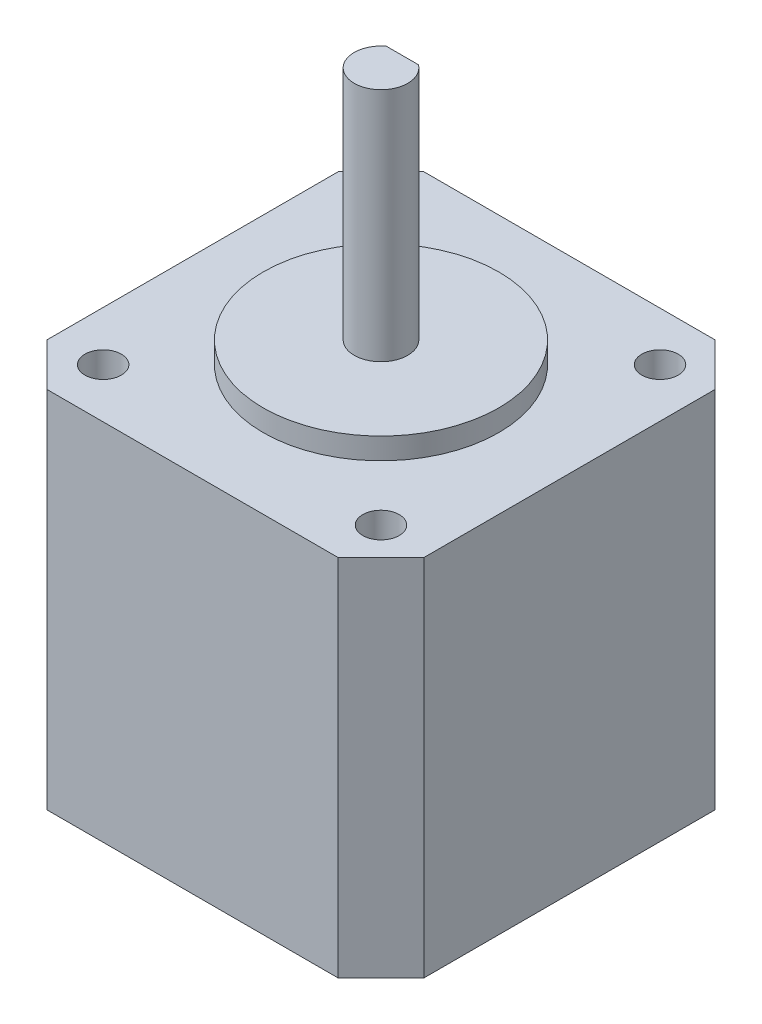
from build123d import *
from build123d.topology import SkipClean

# Parameters (mm, degrees)
SKETCH1_R           = 1.7
BOSS_EXTRUDE1_DEPTH = 34
SKETCH2_R           = 11
BOSS_EXTRUDE2_DEPTH = 2
SKETCH3_R           = 2.5
BOSS_EXTRUDE3_DEPTH = 5.5
BOSS_EXTRUDE4_DEPTH = 16.5


with BuildPart() as part:
    # Sketch1 → Boss-Extrude1 (new body)
    with BuildSketch(Plane(origin=(0, 0, 0), x_dir=(1, 0, 0), z_dir=(0, 1, 0))):
        Polygon((11.828075118, 11.570865707), (-15.371924882, 11.570865707), (-19.371924882, 7.570865707), (-19.371924882, -19.629134293), (-15.371924882, -23.629134293), (11.828075118, -23.629134293), (15.828075118, -19.629134293), (15.828075118, 7.570865707), align=None)
        with Locations((11.255497705, 6.998288294)):
            Circle(SKETCH1_R, mode=Mode.SUBTRACT)
        with Locations((-14.744444327, 6.943385151)):
            Circle(SKETCH1_R, mode=Mode.SUBTRACT)
        with Locations((11.200652531, -19.001711706)):
            Circle(SKETCH1_R, mode=Mode.SUBTRACT)
        with Locations((-14.744502295, -19.001711706)):
            Circle(SKETCH1_R, mode=Mode.SUBTRACT)
    extrude(amount=BOSS_EXTRUDE1_DEPTH)

    # Sketch2 → Boss-Extrude2 (add)
    with BuildSketch(Plane(origin=(0, 34, 0), x_dir=(1, 0, 0), z_dir=(0, 1, 0))):
        with Locations((-1.771924882, -6.029134293)):
            Circle(SKETCH2_R)
    extrude(amount=BOSS_EXTRUDE2_DEPTH)

    # Sketch3 → Boss-Extrude3 (add)
    with BuildSketch(Plane(origin=(0, 36, 0), x_dir=(1, 0, 0), z_dir=(0, 1, 0))):
        with Locations((-1.771924882, -6.029134293)):
            Circle(SKETCH3_R)
    extrude(amount=BOSS_EXTRUDE3_DEPTH)

    # Sketch4 → Boss-Extrude4 (add)
    with SkipClean():  # the faces are left unmerged after this step: merging them gives an invalid solid
        with BuildSketch(Plane(origin=(0, 41.5, 0), x_dir=(1, 0, 0), z_dir=(0, 1, 0))):
            with BuildLine():
                Line((-3.271924882, -4.029134293), (-0.271924882, -4.029134293))
                ThreePointArc((-0.271924882, -4.029134293), (-1.771924882, -8.529134293), (-3.271924882, -4.029134293))
            make_face()
        extrude(amount=BOSS_EXTRUDE4_DEPTH)
    add(part.part.scale(1), mode=Mode.REPLACE)  # the faces are merged on a copy


solid = part.part
